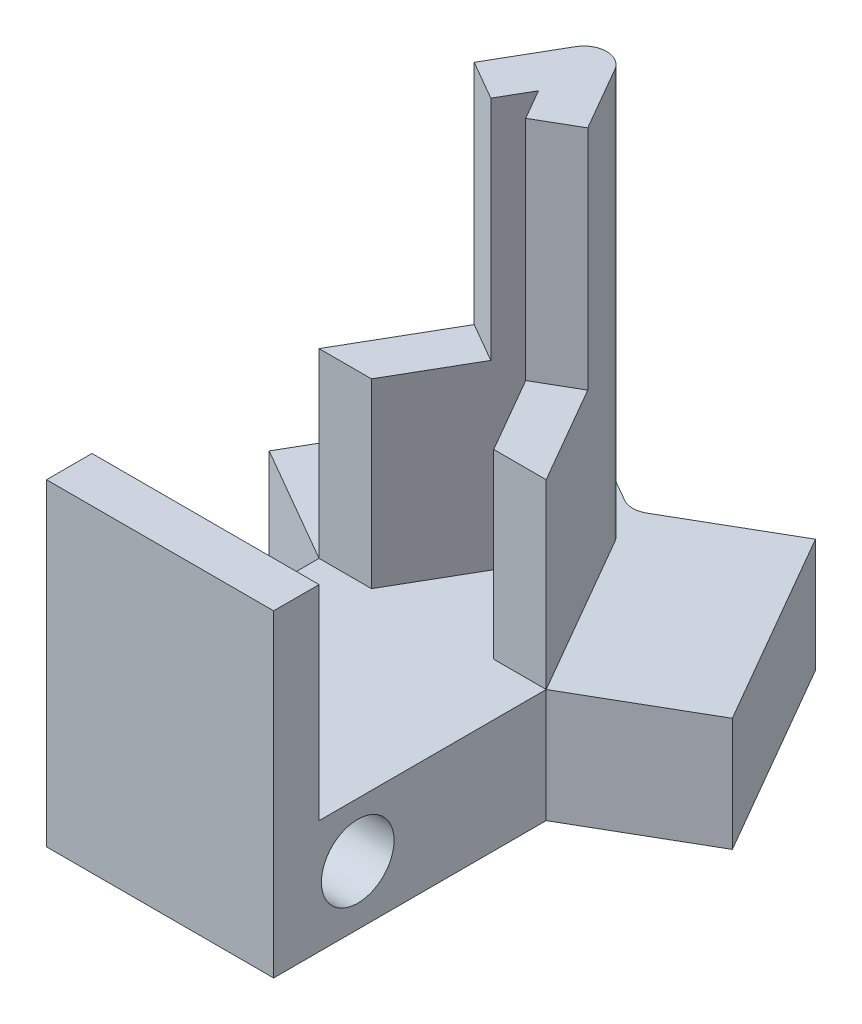
from build123d import *

# Parameters (mm, degrees)
BOSS_EXTRUDE1_DEPTH      = 2
BOSS_EXTRUDE1_DEPTH_BACK = 3
BOSS_EXTRUDE2_DEPTH      = 18
BOSS_EXTRUDE3_DEPTH      = 2
BOSS_EXTRUDE3_DEPTH_BACK = 3
SKETCH8_W                = 10
SKETCH8_H                = 12
SKETCH9_W                = 10
SKETCH9_H                = 2.002012711
BOSS_EXTRUDE4_DEPTH      = 18
CUT_EXTRUDE1_DEPTH       = 10
SKETCH12_W               = 10
SKETCH12_H               = 9
CUT_EXTRUDE3_DEPTH       = 3
FILLET3_R                = 1
FILLET4_R                = 1
SKETCH14_R               = 1.6
CUT_EXTRUDE4_DEPTH       = 3


with BuildPart() as part:
    # Sketch3 → Boss-Extrude1 (new, two sides: drawn at the far end of the back side and taken through both)
    with BuildSketch(Plane(origin=(0, 0, 0), x_dir=(1, 0, 0), z_dir=(0, 1, 0)).offset(-BOSS_EXTRUDE1_DEPTH_BACK)):
        Polygon((-16.281996431, 0), (-6.281996431, 0), (-1.085844009, 3), (-6.085844009, 11.660254038), (-11.281996431, 8.660254038), (-16.478148854, 11.660254038), (-21.478148854, 3), align=None)
    extrude(amount=BOSS_EXTRUDE1_DEPTH + BOSS_EXTRUDE1_DEPTH_BACK)

    # Sketch7 → Boss-Extrude2 (add)
    with BuildSketch(Plane(origin=(0, 2, 0), x_dir=(1, 0, 0), z_dir=(0, 1, 0))):
        Polygon((-6.281996431, 0), (-11.281996431, 8.660254038), (-16.281996431, 0), (-13.972595355, 0), (-12.817894816, 2), (-11.281996431, 4.660254038), (-9.746098047, 2), (-8.591397508, 0), align=None)
    extrude(amount=BOSS_EXTRUDE2_DEPTH)

    # Sketch8 → Boss-Extrude3 (add, two sides: drawn at the far end of the back side and taken through both)
    with BuildSketch(Plane(origin=(0, 0, 0), x_dir=(1, 0, 0), z_dir=(0, 1, 0)).offset(-BOSS_EXTRUDE3_DEPTH_BACK)):
        with Locations((-11.281996431, -6)):
            Rectangle(SKETCH8_W, SKETCH8_H)
    extrude(amount=BOSS_EXTRUDE3_DEPTH + BOSS_EXTRUDE3_DEPTH_BACK)

    # Sketch9 → Boss-Extrude4 (add)
    with BuildSketch(Plane(origin=(0, 2, 0), x_dir=(1, 0, 0), z_dir=(0, 1, 0))):
        with Locations((-11.281996431, -10.998993645)):
            Rectangle(SKETCH9_W, SKETCH9_H)
    extrude(amount=BOSS_EXTRUDE4_DEPTH)

    # Sketch10 → Cut-Extrude1 (cut)
    with BuildSketch(Plane(origin=(0, 20, 0), x_dir=(1, 0, 0), z_dir=(0, 1, 0))):
        Polygon((-13.781996431, 4.330127019), (-16.281996431, 0), (-13.972595355, 0), (-12.049945624, 3.330127019), align=None)
        Polygon((-6.281996431, 0), (-8.781996431, 4.330127019), (-10.514047239, 3.330127019), (-8.591397508, 0), align=None)
    extrude(amount=-CUT_EXTRUDE1_DEPTH, mode=Mode.SUBTRACT)

    # Sketch12 → Cut-Extrude3 (cut)
    with BuildSketch(Plane.XY.offset(12)):
        with Locations((-11.281996431, 15.5)):
            Rectangle(SKETCH12_W, SKETCH12_H)
    extrude(amount=-CUT_EXTRUDE3_DEPTH, mode=Mode.SUBTRACT)

    # Fillet3
    # the kernel refuses this fillet: 1 mm, written as the material it takes off along each edge
    with BuildSketch(Plane(origin=(-11.281996431, 2, -8.660254038), x_dir=(-0.5000000000000031, 0, 0.8660254037844368), z_dir=(0, 1, 0))) as fillet3_piece_1:
        with BuildLine():
            CenterArc((FILLET3_R * 1.73205080757, FILLET3_R), FILLET3_R, 150, 120)
            Line((FILLET3_R * 0.866025403784, FILLET3_R * 1.5), (0, 0))
            Line((0, 0), (FILLET3_R * 1.73205080757, 0))
        make_face()
    extrude(amount=22.330127019, mode=Mode.SUBTRACT)

    # Fillet4
    fillet4_edges = [part.edges().sort_by_distance(p)[0] for p in [
        (-11.281996431, -0.5, -8.660254038),
    ]]
    fillet(fillet4_edges, radius=FILLET4_R)

    # Sketch14 → Cut-Extrude4 (cut)
    with BuildSketch(Plane(origin=(-6.281996431, 0, 0), x_dir=(0, 0, -1), z_dir=(1, 0, 0))):
        with Locations((-8.29856454, -0.4)):
            Circle(SKETCH14_R)
    extrude(amount=-CUT_EXTRUDE4_DEPTH, mode=Mode.SUBTRACT)


solid = part.part
